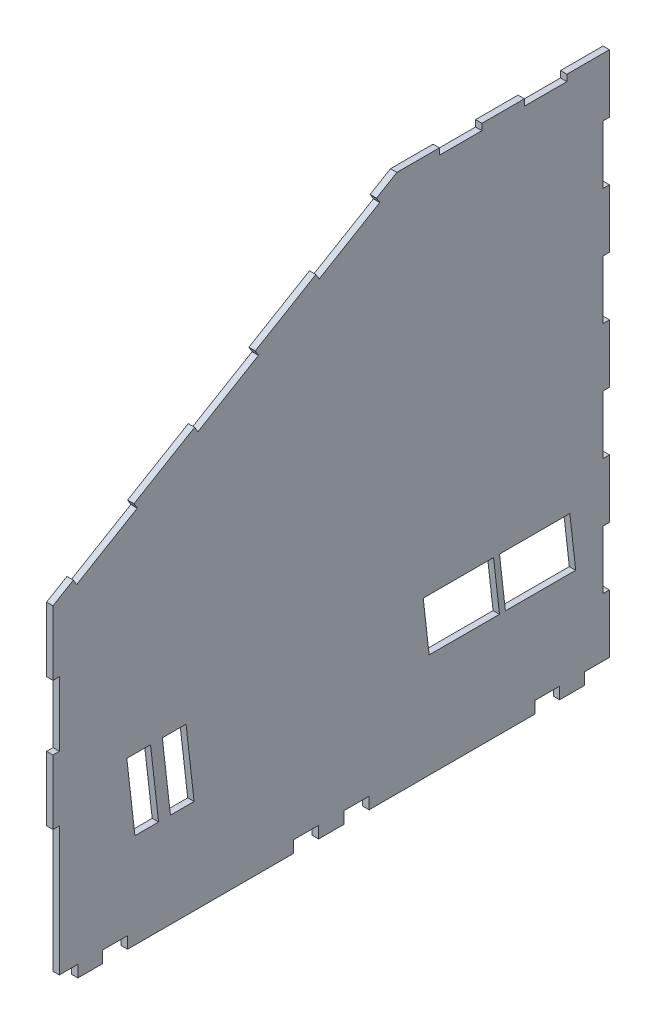
from build123d import *

# Parameters (mm, degrees)
BOSS_EXTRUDE1_DEPTH = 2.7


with BuildPart() as part:
    # Sketch1 → Boss-Extrude1 (new body)
    with BuildSketch(Plane(origin=(0, 0, 0), x_dir=(0, 0, -1), z_dir=(1, 0, 0))):
        Polygon((117.52, 87.8), (117.52, 112.5), (99.566, 112.5), (99.566, 109.8), (81.612, 109.8), (81.612, 112.5), (63.658, 112.5), (63.658, 109.8), (45.704, 109.8), (45.704, 112.5), (27.75, 112.5), (19.142256818, 107.410131897), (20.516521206, 105.086041238), (-5.094381521, 89.941988479), (-6.468645909, 92.266079138), (-32.079548636, 77.122026379), (-30.705284249, 74.79793572), (-56.316186976, 59.653882961), (-57.690451364, 61.977973621), (-83.301354091, 46.833920862), (-81.927089703, 44.509830203), (-107.53799243, 29.365777444), (-108.912256818, 31.689868103), (-117.52, 26.6), (-117.52, -0.68), (-114.82, -0.68), (-114.82, -27.96), (-117.52, -27.96), (-117.52, -55.24), (-114.82, -55.24), (-114.82, -82.52), (-114.82, -109.8), (-107.013333333, -109.8), (-107.013333333, -112.5), (-107.013333333, -114.8), (-96.506666667, -114.8), (-96.506666667, -112.5), (-96.506666667, -109.8), (-86, -109.8), (-86, -112.5), (-86, -114.8), (-16, -114.8), (-16, -112.5), (-16, -109.8), (-5.333333333, -109.8), (-5.333333333, -112.5), (-5.333333333, -114.8), (5.333333333, -114.8), (5.333333333, -112.5), (5.333333333, -109.8), (16, -109.8), (16, -112.5), (16, -114.8), (86, -114.8), (86, -112.5), (86, -109.8), (96.506666667, -109.8), (96.506666667, -112.5), (96.506666667, -114.8), (107.013333333, -114.8), (107.013333333, -112.5), (107.013333333, -109.8), (117.52, -109.8), (117.52, -85.1), (114.82, -85.1), (114.82, -60.4), (117.52, -60.4), (117.52, -35.7), (114.82, -35.7), (114.82, -11), (117.52, -11), (117.52, 13.7), (114.82, 13.7), (114.82, 38.4), (117.52, 38.4), (117.52, 63.1), (114.82, 63.1), (114.82, 87.8), align=None)
        Polygon((-76.32, -44.8), (-72.910909091, -74.8), (-82.910909091, -74.8), (-86.32, -44.8), align=None, mode=Mode.SUBTRACT)
        Polygon((-62.910909091, -74.8), (-67.910909091, -74.8), (-71.32, -44.8), (-66.32, -44.8), (-61.32, -44.8), (-57.910909091, -74.8), align=None, mode=Mode.SUBTRACT)
        Polygon((41.38, -48.8), (68.58, -48.8), (71.08, -70.8), (41.38, -70.8), (38.88, -48.8), align=None, mode=Mode.SUBTRACT)
        Polygon((71.08, -48.8), (100.78, -48.8), (103.28, -70.8), (100.78, -70.8), (73.58, -70.8), align=None, mode=Mode.SUBTRACT)
    extrude(amount=BOSS_EXTRUDE1_DEPTH)


solid = part.part
